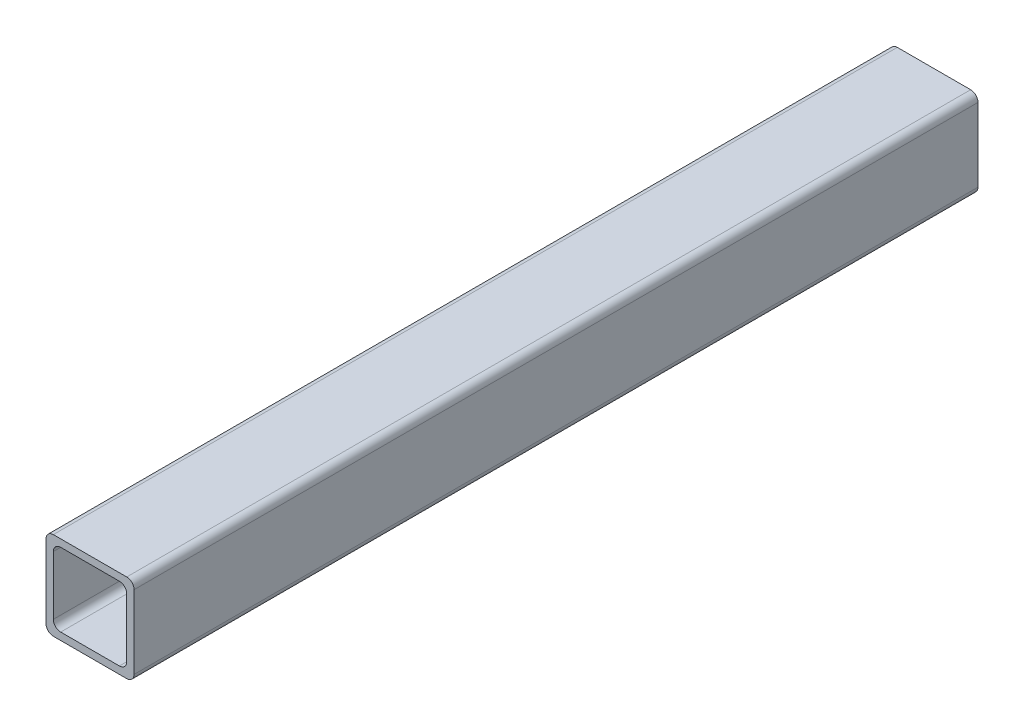
from build123d import *

# Parameters (mm, degrees)
BOSS_EXTRUDE1_DEPTH = 575
SKETCH2_R           = 8.5
CUT_EXTRUDE1_DEPTH  = 10


with BuildPart() as part:
    # Sketch1 → Boss-Extrude1 (new, symmetric)
    with BuildSketch(Plane.XY):
        with BuildLine():
            Line((-50, -60), (50, -60))
            ThreePointArc((50, -60), (57.071067812, -57.071067812), (60, -50))
            Line((60, -50), (60, 50))
            ThreePointArc((60, 50), (57.071067812, 57.071067812), (50, 60))
            Line((50, 60), (-50, 60))
            ThreePointArc((-50, 60), (-57.071067812, 57.071067812), (-60, 50))
            Line((-60, 50), (-60, -50))
            ThreePointArc((-60, -50), (-57.071067812, -57.071067812), (-50, -60))
        make_face()
        with BuildLine():
            Line((-40, -50), (40, -50))
            ThreePointArc((40, -50), (47.071067812, -47.071067812), (50, -40))
            Line((50, -40), (50, 40))
            ThreePointArc((50, 40), (47.071067812, 47.071067812), (40, 50))
            Line((40, 50), (-40, 50))
            ThreePointArc((-40, 50), (-47.071067812, 47.071067812), (-50, 40))
            Line((-50, 40), (-50, -40))
            ThreePointArc((-50, -40), (-47.071067812, -47.071067812), (-40, -50))
        make_face(mode=Mode.SUBTRACT)
    extrude(amount=BOSS_EXTRUDE1_DEPTH, both=True)

    # Sketch2 → Cut-Extrude1 (cut)
    with BuildSketch(Plane.XZ.offset(60)):
        with Locations((0, 501)):
            Circle(SKETCH2_R)
        with Locations((0, -501)):
            Circle(SKETCH2_R)
    extrude(amount=-CUT_EXTRUDE1_DEPTH, mode=Mode.SUBTRACT)


solid = part.part
